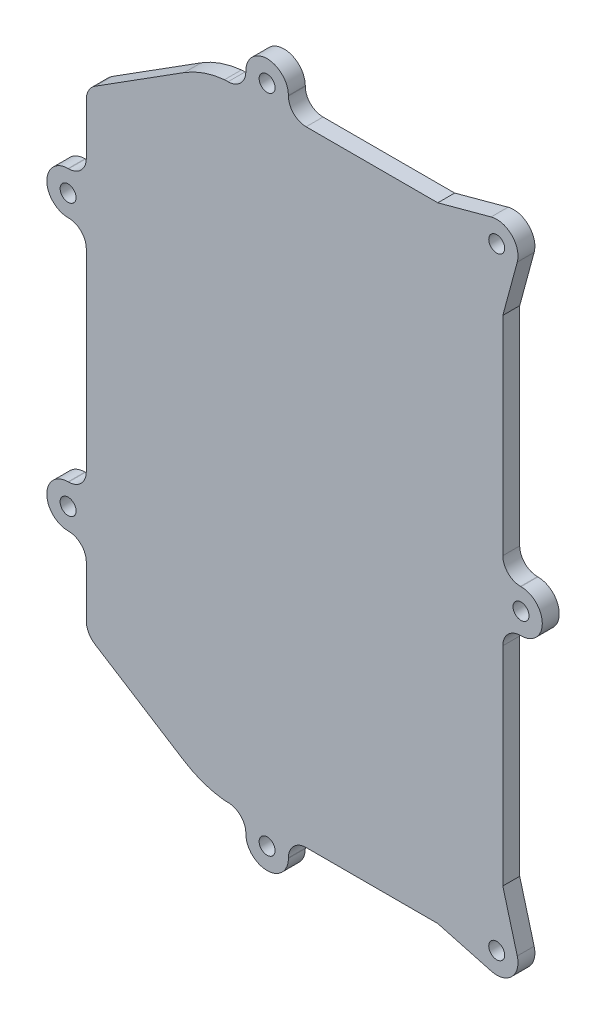
from build123d import *

# Parameters (mm, degrees)
BOSS_EXTRUDE1_DEPTH  = 4.7625
M4_CLEARANCE_HOLE1_D = 4.5


with BuildPart() as part:
    # Sketch1 → Boss-Extrude1 (new body)
    with BuildSketch(Plane.XY):
        with BuildLine():
            Line((-106.928036523, 20.790807977), (-81.789508148, 4.890406962))
            ThreePointArc((-81.789508148, 4.890406962), (-76.336849489, 2.262767283), (-70.428949761, 0.946447586))
            Line((-70.428949761, 0.946447586), (-69.428949761, 0.946447586))
            ThreePointArc((-69.428949761, 0.946447586), (-65.893415855, -0.518018509), (-64.428949761, -4.053552414))
            Line((-64.428949761, -4.053552414), (-64.428949761, -4.186252414))
            ThreePointArc((-64.428949761, -4.186252414), (-58.428949761, -10.186252414), (-52.428949761, -4.186252414))
            Line((-52.428949761, -4.186252414), (-52.428949761, -4.053552414))
            ThreePointArc((-52.428949761, -4.053552414), (-50.964483667, -0.518018509), (-47.428949761, 0.946447586))
            Line((-47.428949761, 0.946447586), (-10.304714314, 0.946447586))
            Line((-10.304714314, 0.946447586), (4.741125454, -3.124101235))
            ThreePointArc((4.741125454, -3.124101235), (10.550693091, -1.574959819), (12.099834507, 4.234607818))
            Line((12.099834507, 4.234607818), (8.029285686, 19.280447586))
            Line((8.029285686, 19.280447586), (8.029285686, 77.946447586))
            ThreePointArc((8.029285686, 77.946447586), (9.49375178, 81.481981491), (13.029285686, 82.946447586))
            Line((13.029285686, 82.946447586), (13.161985686, 82.946447586))
            ThreePointArc((13.161985686, 82.946447586), (19.161985686, 88.946447586), (13.161985686, 94.946447586))
            Line((13.161985686, 94.946447586), (13.029285686, 94.946447586))
            ThreePointArc((13.029285686, 94.946447586), (9.49375178, 96.41091368), (8.029285686, 99.946447586))
            Line((8.029285686, 99.946447586), (8.029285686, 158.612447586))
            Line((8.029285686, 158.612447586), (12.099834507, 173.658287353))
            ThreePointArc((12.099834507, 173.658287353), (10.550693091, 179.46785499), (4.741125454, 181.016996406))
            Line((4.741125454, 181.016996406), (-10.304714314, 176.946447586))
            Line((-10.304714314, 176.946447586), (-47.428949761, 176.946447586))
            ThreePointArc((-47.428949761, 176.946447586), (-50.964483667, 178.41091368), (-52.428949761, 181.946447586))
            Line((-52.428949761, 181.946447586), (-52.428949761, 182.079147586))
            ThreePointArc((-52.428949761, 182.079147586), (-58.428949761, 188.079147586), (-64.428949761, 182.079147586))
            Line((-64.428949761, 182.079147586), (-64.428949761, 181.946447586))
            ThreePointArc((-64.428949761, 181.946447586), (-65.893415855, 178.41091368), (-69.428949761, 176.946447586))
            Line((-69.428949761, 176.946447586), (-70.428949761, 176.946447586))
            ThreePointArc((-70.428949761, 176.946447586), (-76.336849489, 175.630127888), (-81.789508148, 173.002488209))
            Line((-81.789508148, 173.002488209), (-106.928036523, 157.102087194))
            ThreePointArc((-106.928036523, 157.102087194), (-108.749000085, 155.167336799), (-109.410714314, 152.594147791))
            Line((-109.410714314, 152.594147791), (-109.410714314, 138.194147791))
            ThreePointArc((-109.410714314, 138.194147791), (-110.875180408, 134.658613885), (-114.410714314, 133.194147791))
            Line((-114.410714314, 133.194147791), (-114.543414314, 133.194147791))
            ThreePointArc((-114.543414314, 133.194147791), (-120.543414314, 127.194147791), (-114.543414314, 121.194147791))
            Line((-114.543414314, 121.194147791), (-114.410714314, 121.194147791))
            ThreePointArc((-114.410714314, 121.194147791), (-110.875180408, 119.729681697), (-109.410714314, 116.194147791))
            Line((-109.410714314, 116.194147791), (-109.410714314, 61.69874738))
            ThreePointArc((-109.410714314, 61.69874738), (-110.875180408, 58.163213474), (-114.410714314, 56.69874738))
            Line((-114.410714314, 56.69874738), (-114.543414314, 56.69874738))
            ThreePointArc((-114.543414314, 56.69874738), (-120.543414314, 50.69874738), (-114.543414314, 44.69874738))
            Line((-114.543414314, 44.69874738), (-114.410714314, 44.69874738))
            ThreePointArc((-114.410714314, 44.69874738), (-110.875180408, 43.234281286), (-109.410714314, 39.69874738))
            Line((-109.410714314, 39.69874738), (-109.410714314, 25.29874738))
            ThreePointArc((-109.410714314, 25.29874738), (-108.749000085, 22.725558372), (-106.928036523, 20.790807977))
        make_face()
    extrude(amount=-BOSS_EXTRUDE1_DEPTH)

    # M4 Clearance Hole1 (through all)
    with Locations(Plane(origin=(0, 0, -4.7625), x_dir=(-1, 0, 0), z_dir=(0, 0, -1))):
        with Locations((-6.308052404, 175.225214303), (-13.161985686, 88.946447586), (-6.308052404, 2.667680868), (114.543414314, 50.69874738), (114.543414314, 127.194147791), (58.428949761, 182.079147586), (58.428949761, -4.186252414)):
            Hole(M4_CLEARANCE_HOLE1_D / 2)


solid = part.part
